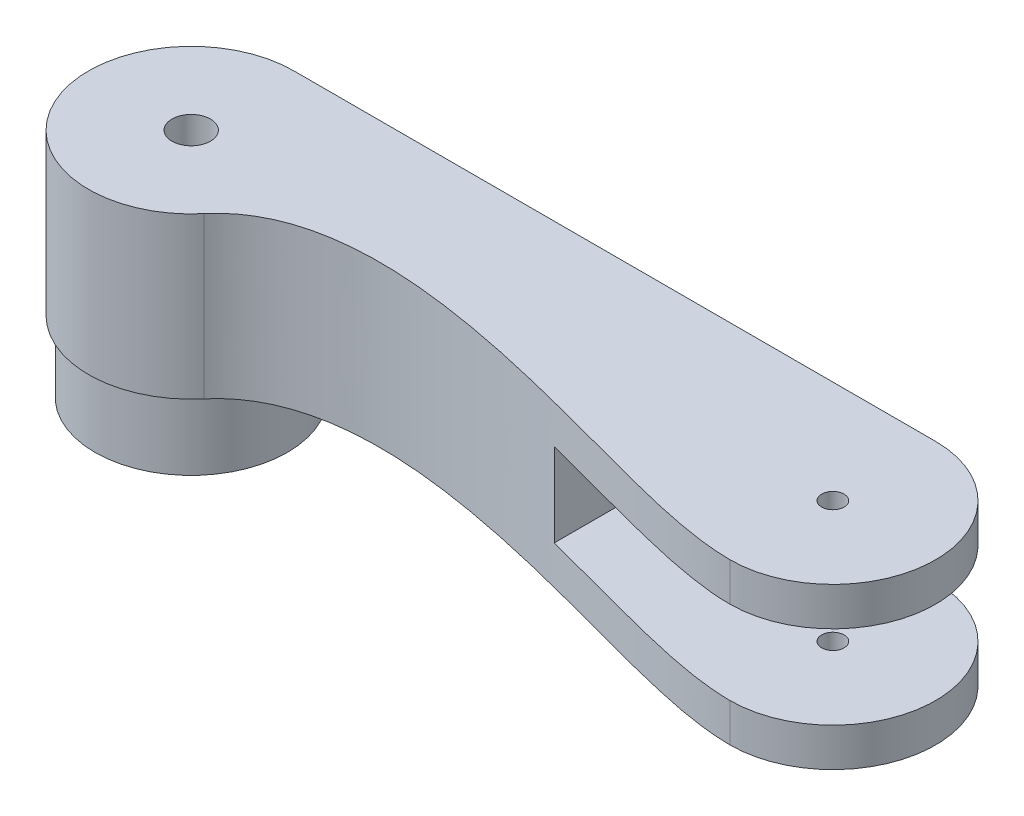
from build123d import *

# Parameters (mm, degrees)
BOSS_EXTRUDE1_DEPTH     = 6
SKETCH3_R               = 1.75
CUT_EXTRUDE2_DEPTH      = 69.176242196
BOSS_EXTRUDE2_DEPTH     = 13
BOSS_EXTRUDE3_DEPTH     = 6
CUT_EXTRUDE3_REACH      = 74.367
SKETCH6_R               = 1.75
CUT_EXTRUDE4_REACH      = 74.367
SKETCH8_R               = 15
BOSS_EXTRUDE4_DEPTH     = 11
SKETCH9_R               = 2.55
CUT_EXTRUDE5_DEPTH      = 6
CUT_EXTRUDE6_DEPTH      = 77.863515556
CUT_EXTRUDE6_DEPTH_BACK = 77.863515556
SKETCH11_R              = 3


with BuildPart() as part:
    # Sketch1 → Boss-Extrude1 (new body)
    with BuildSketch(Plane(origin=(0, 0, 0), x_dir=(1, 0, 0), z_dir=(0, 1, 0))):
        with BuildLine():
            Line((-50, 16), (50, 16))
            ThreePointArc((50, 16), (66, 0), (50, -16))
            Line((50, -16), (-50, -16))
            ThreePointArc((-50, -16), (-66, 0), (-50, 16))
        make_face()
    extrude(amount=BOSS_EXTRUDE1_DEPTH)

    # Sketch3 → Cut-Extrude2 (cut, through all)
    with BuildSketch(Plane.XZ):
        with Locations((50, 0)):
            Circle(SKETCH3_R)
    extrude(amount=-CUT_EXTRUDE2_DEPTH, mode=Mode.SUBTRACT)

    # Sketch4 → Boss-Extrude2 (add)
    with BuildSketch(Plane(origin=(0, 6, 0), x_dir=(1, 0, 0), z_dir=(0, 1, 0))):
        with BuildLine():
            Line((-50, 16), (15, 16))
            Line((15, 16), (15, -16))
            Line((15, -16), (-50, -16))
            ThreePointArc((-50, -16), (-66, 0), (-50, 16))
        make_face()
    extrude(amount=BOSS_EXTRUDE2_DEPTH)

    # Sketch5 → Boss-Extrude3 (add)
    with BuildSketch(Plane(origin=(0, 19, 0), x_dir=(1, 0, 0), z_dir=(0, 1, 0))):
        with BuildLine():
            Line((-50, 16), (50, 16))
            ThreePointArc((50, 16), (66, 0), (50, -16))
            Line((50, -16), (-50, -16))
            ThreePointArc((-50, -16), (-66, 0), (-50, 16))
        make_face()
    extrude(amount=BOSS_EXTRUDE3_DEPTH)

    # Sketch6 → Cut-Extrude3 (cut, up to next)
    with BuildSketch(Plane(origin=(0, 25, 0), x_dir=(1, 0, 0), z_dir=(0, 1, 0)), mode=Mode.PRIVATE) as cut_extrude3_sk1:
        with Locations((50, 0)):
            Circle(SKETCH6_R)
    cut_extrude3_tool1 = extrude(cut_extrude3_sk1.sketch, amount=-CUT_EXTRUDE3_REACH, mode=Mode.PRIVATE) & part.part
    add(cut_extrude3_tool1.solids().sort_by_distance((50, 25, 0))[0], mode=Mode.SUBTRACT)

    # Sketch7 → Cut-Extrude4 (cut, up to next)
    with BuildSketch(Plane(origin=(0, 25, 0), x_dir=(1, 0, 0), z_dir=(0, 1, 0)), mode=Mode.PRIVATE) as cut_extrude4_sk1:
        with BuildLine():
            ThreePointArc((-37.731263809, -10.270253759), (-43.22962557, -14.496966237), (-50, -16))
            Line((-50, -16), (50, -16))
            add(Edge.make_bspline(
                [(-37.731263809, -10.270253759), (-30.332556703, -1.431836739), (6.050402888, -3.364587973), (38.512231583, -16), (50, -16)],
                knots=[0, 0, 0, 0, 0.426660683, 1, 1, 1, 1], degree=3))
        make_face()
    cut_extrude4_tool1 = extrude(cut_extrude4_sk1.sketch, amount=-CUT_EXTRUDE4_REACH, mode=Mode.PRIVATE) & part.part
    add(cut_extrude4_tool1.solids().sort_by_distance((-6.915299, 25, 11.013102))[0], mode=Mode.SUBTRACT)

    # Sketch8 → Boss-Extrude4 (add)
    with BuildSketch(Plane.XZ):
        with Locations((-50, 0)):
            Circle(SKETCH8_R)
    extrude(amount=BOSS_EXTRUDE4_DEPTH)

    # Sketch9 → Cut-Extrude5 (cut)
    with BuildSketch(Plane.XZ.offset(11)):
        with Locations((-50, 6.75)):
            Circle(SKETCH9_R)
        with Locations((-50, -6.75)):
            Circle(SKETCH9_R)
    extrude(amount=-CUT_EXTRUDE5_DEPTH, mode=Mode.SUBTRACT)

    # Sketch11 → Cut-Extrude6 (cut, two sides: drawn at the far end of the back side and taken through both)
    with BuildSketch(Plane.XZ.offset(11).offset(-CUT_EXTRUDE6_DEPTH_BACK)):
        with Locations((-50, 0)):
            Circle(SKETCH11_R)
    extrude(amount=CUT_EXTRUDE6_DEPTH + CUT_EXTRUDE6_DEPTH_BACK, mode=Mode.SUBTRACT)


solid = part.part
